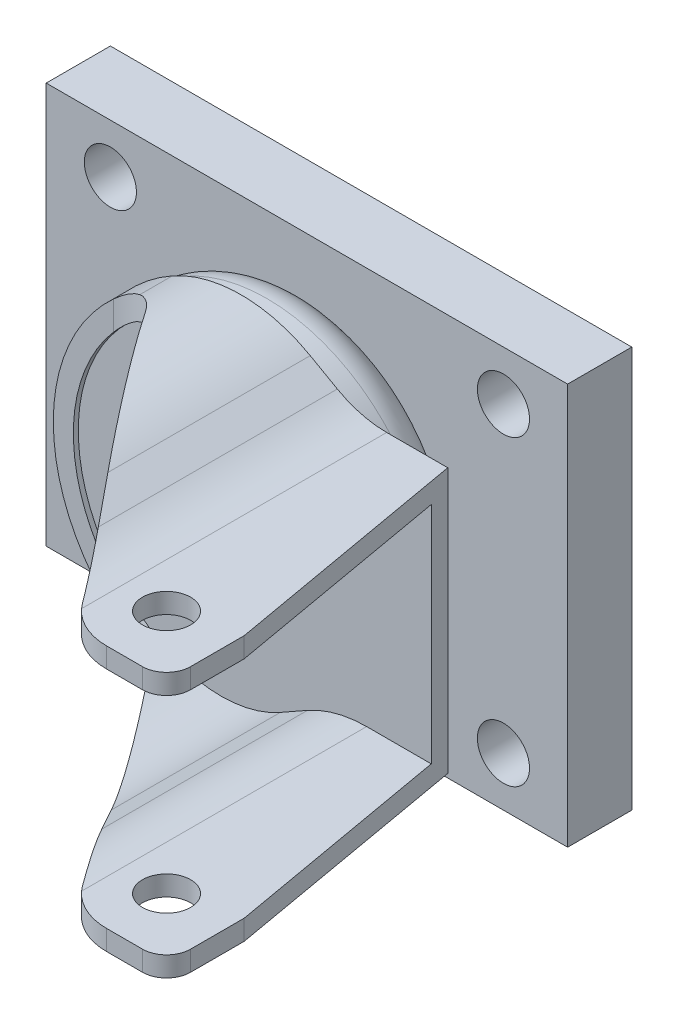
from build123d import *

# Parameters (mm, degrees)
EXTRUDE_1_DEPTH     = 46.5
SKETCH_4_OUTSIDE_W  = 66.66
SKETCH_4_OUTSIDE_H  = 64.16
CUT_EXTRUDE_1_DEPTH = 50
SHELL_START         = 6
SHELL_1_DEPTH       = 40.5
SHELL_START_2       = 8.5
SHELL_1_2_DEPTH     = 38
SHELL_START_3       = -22.293752824
SHELL_1_3_DEPTH     = 44.587505647
SKETCH_5_R          = 20.5
EXTRUDE_3_DEPTH     = 8
FILLET_1_R          = 5
SKETCH_4_8_R        = 3
CUT_EXTRUDE_3_DEPTH = 48
FILLET_3_R          = 3
SKETCH_8_W          = 65
SKETCH_8_H          = 50
SKETCH_8_R          = 3.25
EXTRUDE_4_DEPTH     = 8


with BuildPart() as part:
    # 草图1 → 凸台-拉伸1 (new body)
    with BuildSketch(Plane.XY):
        with BuildLine():
            ThreePointArc((35.945795724, -14), (32.1298187, -14.493507683), (28.564936874, -15.941557419))
            Line((28.564936874, -15.941557419), (25.184577361, -17.852195404))
            ThreePointArc((25.184577361, -17.852195404), (17.819425425, -19.7937446), (10.450223542, -17.867624161))
            ThreePointArc((10.450223542, -17.867624161), (0, 0), (10.450223542, 17.867624161))
            ThreePointArc((10.450223542, 17.867624161), (17.819425425, 19.7937446), (25.184577361, 17.852195404))
            Line((25.184577361, 17.852195404), (28.564936874, 15.941557419))
            ThreePointArc((28.564936874, 15.941557419), (32.1298187, 14.493507683), (35.945795724, 14))
            Line((35.945795724, 14), (49, 14))
            Line((49, 14), (49, -14))
            Line((49, -14), (35.945795724, -14))
        make_face()
    extrude(amount=EXTRUDE_1_DEPTH)

    # 草图4 outside → 切除-拉伸1 (cut, symmetric)
    with BuildSketch(Plane.XZ.offset(14)):
        with Locations((24.5, 23.25)):
            Rectangle(SKETCH_4_OUTSIDE_W, SKETCH_4_OUTSIDE_H)
        with BuildLine():
            Line((49, 36.813688531), (44, 8.5))
            Line((44, 8.5), (0, 8.5))
            Line((0, 8.5), (0, 9.114014501))
            Line((0, 9.114014501), (5, 9.114014501))
            ThreePointArc((5, 9.114014501), (9.499546785, 10.183500589), (13.036653031, 13.163198754))
            Line((13.036653031, 13.163198754), (35.472510226, 43.46311181))
            ThreePointArc((35.472510226, 43.46311181), (38.125339912, 45.697885434), (41.5, 46.5))
            Line((41.5, 46.5), (49, 46.5))
            Line((49, 46.5), (49, 36.813688531))
        make_face(mode=Mode.SUBTRACT)
    extrude(amount=CUT_EXTRUDE_1_DEPTH, both=True, mode=Mode.SUBTRACT)

    # 抽壳1: read off the stored shape, not the designer's step
    # 抽壳1 outline → 抽壳1 (add)
    with BuildSketch(Plane.XY.offset(SHELL_START)):
        with BuildLine():
            Line((49, -16.5), (49, 16.5))
            Line((49, 16.5), (35.945796372, 16.5))
            ThreePointArc((35.945796372, 16.5), (32.765815184, 16.91125632), (29.795080015, 18.117964516))
            Line((29.795080015, 18.117964516), (26.414720503, 20.028602501))
            ThreePointArc((26.414720503, 20.028602501), (17.822043244, 22.293743229), (9.224641048, 20.046602717))
            ThreePointArc((9.224641048, 20.046602717), (-2.5, 3.232e-06), (9.224641048, -20.046602717))
            ThreePointArc((9.224641048, -20.046602717), (17.822043244, -22.293743229), (26.414720503, -20.028602501))
            Line((26.414720503, -20.028602501), (29.795080015, -18.117964516))
            ThreePointArc((29.795080015, -18.117964516), (32.765815184, -16.91125632), (35.945796372, -16.5))
            Line((35.945796372, -16.5), (49, -16.5))
        make_face()
    extrude(amount=SHELL_1_DEPTH)

    # Shell 1 2 outline → Shell 1 2 (cut)
    with BuildSketch(Plane.XY.offset(SHELL_START_2)):
        with BuildLine():
            Line((25.184577361, -17.852195404), (28.564936874, -15.941557419))
            ThreePointArc((28.564936874, -15.941557419), (32.129818701, -14.493507683), (35.945795724, -14))
            Line((35.945795724, -14), (49, -14))
            Line((49, -14), (49, 14))
            Line((49, 14), (35.945795724, 14))
            ThreePointArc((35.945795724, 14), (32.129818701, 14.493507683), (28.564936874, 15.941557419))
            Line((28.564936874, 15.941557419), (25.184577361, 17.852195404))
            ThreePointArc((25.184577361, 17.852195404), (17.819425424, 19.7937446), (10.450223542, 17.867624161))
            ThreePointArc((10.450223542, 17.867624161), (0, 0), (10.450223542, -17.867624161))
            ThreePointArc((10.450223542, -17.867624161), (17.819425424, -19.7937446), (25.184577361, -17.852195404))
        make_face()
    extrude(amount=SHELL_1_2_DEPTH, mode=Mode.SUBTRACT)

    # Shell 1 3 outline → Shell 1 3 (cut)
    with BuildSketch(Plane(origin=(0, 0, 0), x_dir=(1, 0, 0), z_dir=(0, 1, 0)).offset(SHELL_START_3)):
        with BuildLine():
            Line((-4, -46.5), (41.5, -46.5))
            ThreePointArc((41.5, -46.5), (38.125339907, -45.697885432), (35.47251022, -43.463111802))
            Line((35.47251022, -43.463111802), (13.036653031, -13.163198754))
            ThreePointArc((13.036653031, -13.163198754), (9.499546673, -10.183500533), (4.999999751, -9.114014501))
            Line((4.999999751, -9.114014501), (-4, -9.114014501))
            Line((-4, -9.114014501), (-4, -46.5))
        make_face()
        Polygon((49, -36.813688531), (49, -6), (43.558517429, -6), align=None)
    extrude(amount=SHELL_1_3_DEPTH, mode=Mode.SUBTRACT)

    # 草图5 → 凸台-拉伸3 (add)
    with BuildSketch(Plane(origin=(0, 0, 6), x_dir=(-1, 0, 0), z_dir=(0, 0, -1))):
        with Locations(Location((-18, 0, 0), (0, 0, 359.999469823))):
            Circle(SKETCH_5_R)
    extrude(amount=EXTRUDE_3_DEPTH)

    # 圆角1
    fillet_1_edges = [part.edges().sort_by_distance(p)[0] for p in [
        (38.499999999, 0.000189693, -2),
    ]]
    fillet(fillet_1_edges, radius=FILLET_1_R)

    # 草图4<8> → 切除-拉伸3 (cut, symmetric)
    with BuildSketch(Plane.XZ.offset(14)):
        with Locations(Location((41.5, 39, 0), (0, 0, 270))):
            Circle(SKETCH_4_8_R)
    extrude(amount=CUT_EXTRUDE_3_DEPTH, both=True, mode=Mode.SUBTRACT)

    # 圆角3
    fillet_3_edges = [part.edges().sort_by_distance(p)[0] for p in [
        (49, -15.25, 46.5),
        (49, 15.25, 46.5),
    ]]
    fillet(fillet_3_edges, radius=FILLET_3_R)

    # 草图8 → 凸台-拉伸4 (add)
    with BuildSketch(Plane(origin=(0, 0, -2), x_dir=(-1, 0, 0), z_dir=(0, 0, -1))):
        with Locations((-18, 0)):
            Rectangle(SKETCH_8_W, SKETCH_8_H)
        with Locations((6.5, 18.846153846)):
            Circle(SKETCH_8_R, mode=Mode.SUBTRACT)
        with Locations((6.5, -18.846153846)):
            Circle(SKETCH_8_R, mode=Mode.SUBTRACT)
        with Locations((-42.5, -18.846153846)):
            Circle(SKETCH_8_R, mode=Mode.SUBTRACT)
        with Locations((-42.5, 18.846153846)):
            Circle(SKETCH_8_R, mode=Mode.SUBTRACT)
    extrude(amount=EXTRUDE_4_DEPTH)


solid = part.part
